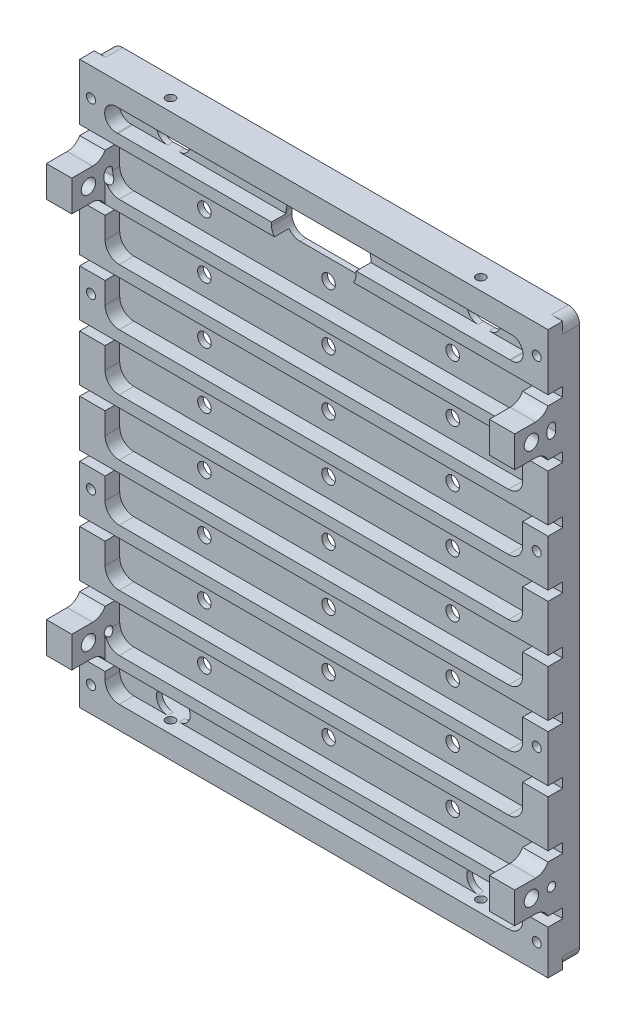
from build123d import *

# Parameters (mm, degrees)
SKETCH1_W                                 = 83
SKETCH1_H                                 = 49.75
BOSS_EXTRUDE1_DEPTH                       = 2.6
BOSS_EXTRUDE3_DEPTH                       = 3
SKETCH3_W                                 = 74
SKETCH3_H                                 = 91.5
CUT_EXTRUDE1_DEPTH                        = 2.6
SKETCH6_W                                 = 19.5
SKETCH6_H                                 = 24.25
SKETCH6_W_2                               = 30
SKETCH6_H_2                               = 37
CUT_EXTRUDE4_DEPTH                        = 2
FILLET6_R                                 = 2.5
FILLET6_OF_MIRROR7_R                      = 2.5
FILLET33_R                                = 2.5
SKETCH75_W                                = 74
SKETCH75_H                                = 2
BOSS_EXTRUDE17_DEPTH                      = 2.6
M2_CLEARANCE_HOLE2_D                      = 2.4
LPATTERN5_COUNT                           = 8
LPATTERN5_PITCH                           = 10
FILLET31_R                                = 2.5
SKETCH14_W                                = 2.6
SKETCH14_H                                = 1.7
CUT_EXTRUDE5_DEPTH                        = 65.856090693
LPATTERN2_COUNT                           = 9
LPATTERN2_PITCH                           = 10
M2X0_4_TAPPED_HOLE1_D                     = 1.6
CUT_EXTRUDE2_DEPTH                        = 65.856090693
CUT_EXTRUDE2_DEPTH_BACK                   = 65.856090693
SKETCH4_W                                 = 15
SKETCH4_H                                 = 6
FILLET4_R                                 = 2.5
SKETCH62_W                                = 4.5
SKETCH62_H                                = 8.4
BOSS_EXTRUDE15_DEPTH                      = 5.9
TAPPED_HOLE_FOR_M2_5X0_45_HELICOIL1_D     = 2.55
TAPPED_HOLE_FOR_M2_5X0_45_HELICOIL1_DEPTH = 83
F_1_5MM_START                             = 34.5
F_1_5MM_DOWEL_HOLE2_OUTLINE_R             = 0.75
F_1_5MM_DOWEL_HOLE2_DEPTH                 = 7.5
CUT_EXTRUDE28_DEPTH                       = 98.140684147
CUT_EXTRUDE28_DEPTH_BACK                  = 98.140684147
CUT_EXTRUDE27_START                       = -4.5
CUT_EXTRUDE27_DEPTH                       = 4.5
FILLET29_R                                = 2.5
M2X0_4_TAPPED_HOLE4_D                     = 1.6
M2X0_4_TAPPED_HOLE4_DEPTH                 = 4
M2X0_4_TAPPED_HOLE4_TIP                   = 0.480688495
M2X0_4_TAPPED_HOLE6_D                     = 1.6
M2X0_4_TAPPED_HOLE6_DEPTH                 = 4
M2X0_4_TAPPED_HOLE6_TIP                   = 0.480688495
TOPCUT_DEPTH                              = 66.341889384
CUT_EXTRUDE32_DEPTH                       = 3


with BuildPart() as part:
    # Sketch1 → Boss-Extrude1 (new body)
    with BuildSketch(Plane.XY):
        with Locations((0, 24.875)):
            Rectangle(SKETCH1_W, SKETCH1_H)
        with Locations((0, -24.875)):
            Rectangle(SKETCH1_W, SKETCH1_H)
    extrude(amount=BOSS_EXTRUDE1_DEPTH)

    # Sketch2 → Boss-Extrude3 (add)
    with BuildSketch(Plane.XY):
        with BuildLine():
            ThreePointArc((41.5, 47.75), (40.914213562, 49.164213562), (39.5, 49.75))
            Line((39.5, 49.75), (-39.5, 49.75))
            ThreePointArc((-39.5, 49.75), (-40.914213562, 49.164213562), (-41.5, 47.75))
            Line((-41.5, 47.75), (-41.5, -47.75))
            ThreePointArc((-41.5, -47.75), (-40.914213562, -49.164213562), (-39.5, -49.75))
            Line((-39.5, -49.75), (39.5, -49.75))
            ThreePointArc((39.5, -49.75), (40.914213562, -49.164213562), (41.5, -47.75))
            Line((41.5, -47.75), (41.5, 47.75))
        make_face()
    extrude(amount=-BOSS_EXTRUDE3_DEPTH)

    # Sketch3 → Cut-Extrude1 (cut)
    with BuildSketch(Plane.XY.offset(2.6)):
        Rectangle(SKETCH3_W, SKETCH3_H)
    extrude(amount=-CUT_EXTRUDE1_DEPTH, mode=Mode.SUBTRACT)

    # Sketch6 → Cut-Extrude4 (cut)
    with BuildSketch(Plane(origin=(0, 0, -3), x_dir=(-1, 0, 0), z_dir=(0, 0, -1))):
        with Locations((-27.75, 33.625)):
            Rectangle(SKETCH6_W, SKETCH6_H)
        with Locations((0, 33.625)):
            Rectangle(SKETCH6_W_2, SKETCH6_H)
        with Locations((27.75, 33.625)):
            Rectangle(SKETCH6_W, SKETCH6_H)
        with Locations((-27.75, 0)):
            Rectangle(SKETCH6_W, SKETCH6_H_2)
        Rectangle(SKETCH6_W_2, SKETCH6_H_2)
        with Locations((27.75, 0)):
            Rectangle(SKETCH6_W, SKETCH6_H_2)
        with Locations((-27.75, -33.625)):
            Rectangle(SKETCH6_W, SKETCH6_H)
        with Locations((0, -33.625)):
            Rectangle(SKETCH6_W_2, SKETCH6_H)
        with Locations((27.75, -33.625)):
            Rectangle(SKETCH6_W, SKETCH6_H)
    cut_extrude4 = extrude(amount=-CUT_EXTRUDE4_DEPTH, mode=Mode.SUBTRACT)

    # Fillet6
    fillet6_edges = [part.edges().sort_by_distance(p)[0] for p in [
        (15, -45.75, -2),
        (15, -21.5, -2),
        (-15, -21.5, -2),
        (-15, -45.75, -2),
        (37.5, -45.75, -2),
        (37.5, -21.5, -2),
        (18, -21.5, -2),
        (18, -45.75, -2),
        (-18, -18.5, -2),
        (-18, 18.5, -2),
        (-37.5, 18.5, -2),
        (-37.5, -18.5, -2),
        (37.5, 21.5, -2),
        (37.5, 45.75, -2),
        (18, 45.75, -2),
        (18, 21.5, -2),
        (15, 21.5, -2),
        (15, 45.75, -2),
        (-15, 45.75, -2),
        (-15, 21.5, -2),
        (-18, 21.5, -2),
        (-18, 45.75, -2),
        (-37.5, 45.75, -2),
        (-37.5, 21.5, -2),
        (37.5, -18.5, -2),
        (37.5, 18.5, -2),
        (18, 18.5, -2),
        (18, -18.5, -2),
        (15, -18.5, -2),
        (15, 18.5, -2),
        (-15, 18.5, -2),
        (-15, -18.5, -2),
        (-18, -45.75, -2),
        (-18, -21.5, -2),
        (-37.5, -21.5, -2),
        (-37.5, -45.75, -2),
    ]]
    fillet(fillet6_edges, radius=FILLET6_R)

    # Mirror7: Cut-Extrude4 across plane
    add(cut_extrude4.mirror(Plane.ZX), mode=Mode.SUBTRACT)

    # Fillet6 of Mirror7
    fillet6_of_mirror7_edges = [part.edges().sort_by_distance(p)[0] for p in [
        (15, 45.75, -2),
        (15, 21.5, -2),
        (-15, 21.5, -2),
        (-15, 45.75, -2),
        (37.5, 45.75, -2),
        (37.5, 21.5, -2),
        (18, 21.5, -2),
        (18, 45.75, -2),
        (-18, 18.5, -2),
        (-18, -18.5, -2),
        (-37.5, -18.5, -2),
        (-37.5, 18.5, -2),
        (37.5, -21.5, -2),
        (37.5, -45.75, -2),
        (18, -45.75, -2),
        (18, -21.5, -2),
        (15, -21.5, -2),
        (15, -45.75, -2),
        (-15, -45.75, -2),
        (-15, -21.5, -2),
        (-18, -21.5, -2),
        (-18, -45.75, -2),
        (-37.5, -45.75, -2),
        (-37.5, -21.5, -2),
        (37.5, 18.5, -2),
        (37.5, -18.5, -2),
        (18, -18.5, -2),
        (18, 18.5, -2),
        (15, 18.5, -2),
        (15, -18.5, -2),
        (-15, -18.5, -2),
        (-15, 18.5, -2),
        (-18, 45.75, -2),
        (-18, 21.5, -2),
        (-37.5, 21.5, -2),
        (-37.5, 45.75, -2),
    ]]
    fillet(fillet6_of_mirror7_edges, radius=FILLET6_OF_MIRROR7_R)

    # Fillet33
    fillet33_edges = [part.edges().sort_by_distance(p)[0] for p in [
        (-37, -45.75, 1.3),
        (-37, 45.75, 1.3),
        (37, 45.75, 1.3),
        (37, -45.75, 1.3),
    ]]
    fillet(fillet33_edges, radius=FILLET33_R)

    # Sketch75 → Boss-Extrude17 (add)
    with BuildSketch(Plane.XY):
        with Locations((0, 40.75)):
            Rectangle(SKETCH75_W, SKETCH75_H)
        with Locations((0, 30.75)):
            Rectangle(SKETCH75_W, SKETCH75_H)
        with Locations((0, 20.75)):
            Rectangle(SKETCH75_W, SKETCH75_H)
        with Locations((0, 10.75)):
            Rectangle(SKETCH75_W, SKETCH75_H)
        with Locations((0, 0.75)):
            Rectangle(SKETCH75_W, SKETCH75_H)
        with Locations((0, -9.25)):
            Rectangle(SKETCH75_W, SKETCH75_H)
        with Locations((0, -19.25)):
            Rectangle(SKETCH75_W, SKETCH75_H)
        with Locations((0, -29.25)):
            Rectangle(SKETCH75_W, SKETCH75_H)
        with Locations((0, -39.25)):
            Rectangle(SKETCH75_W, SKETCH75_H)
    extrude(amount=BOSS_EXTRUDE17_DEPTH)

    # M2 Clearance Hole2 (through all)
    with Locations(Plane(origin=(0, 0, -1), x_dir=(-1, 0, 0), z_dir=(0, 0, -1))):
        with Locations((0, -34.85), (22, -34.85), (-22, -34.85)):
            m2_clearance_hole2 = Hole(M2_CLEARANCE_HOLE2_D / 2)

    # LPattern5: M2 Clearance Hole2 ×8
    with Locations(*[(0, i * LPATTERN5_PITCH, 0) for i in range(1, LPATTERN5_COUNT)]):
        add(m2_clearance_hole2, mode=Mode.SUBTRACT)

    # Fillet31
    # the kernel refuses this fillet: 2.5 mm, written as the material it adds along each edge
    with BuildSketch(Plane(origin=(37, 41.75, 0), x_dir=(0, 1, 0), z_dir=(0, 0, 1))) as fillet31_piece_1:
        with BuildLine():
            CenterArc((2.5, 2.291287847), FILLET31_R, 180, 66.421821522)
            Line((0, 2.291287847), (-0.05, 2.291287847))
            Line((-0.05, 2.291287847), (-0.05, 0))
            Line((-0.05, 0), (0, -0.05))
            ThreePointArc((0, -0.05), (0.75, -0.05), (1.48, -0.045825757))
            Line((1.48, -0.045825757), (1.5, 0))
        make_face()
    extrude(amount=2.6)
    with BuildSketch(Plane(origin=(-37, 41.75, 0), x_dir=(0, 1, 0), z_dir=(0, 0, 1))) as fillet31_piece_2:
        with BuildLine():
            CenterArc((2.5, -2.291287847), FILLET31_R, 113.578178478, 66.421821522)
            Line((0, -2.291287847), (-0.05, -2.291287847))
            Line((-0.05, -2.291287847), (-0.05, 0))
            Line((-0.05, 0), (0, 0.05))
            ThreePointArc((0, 0.05), (0.75, 0.05), (1.48, 0.045825757))
            Line((1.48, 0.045825757), (1.5, 0))
        make_face()
    extrude(amount=2.6)
    with BuildSketch(Plane(origin=(37, 21.75, 0), x_dir=(0, 1, 0), z_dir=(0, 0, 1)), Plane(origin=(37, -38.25, 0), x_dir=(0, 1, 0), z_dir=(0, 0, 1)), Plane(origin=(37, 11.75, 0), x_dir=(0, 1, 0), z_dir=(0, 0, 1)), Plane(origin=(37, 1.75, 0), x_dir=(0, 1, 0), z_dir=(0, 0, 1)), Plane(origin=(37, -8.25, 0), x_dir=(0, 1, 0), z_dir=(0, 0, 1)), Plane(origin=(37, -18.25, 0), x_dir=(0, 1, 0), z_dir=(0, 0, 1)), Plane(origin=(37, -28.25, 0), x_dir=(0, 1, 0), z_dir=(0, 0, 1)), Plane(origin=(37, 31.75, 0), x_dir=(0, 1, 0), z_dir=(0, 0, 1))) as fillet31_piece_3:
        with BuildLine():
            CenterArc((FILLET31_R, FILLET31_R), FILLET31_R, 180, 90)
            Line((0, FILLET31_R), (-FILLET31_R * 0.0199999999999, FILLET31_R))
            Line((-FILLET31_R * 0.0199999999999, FILLET31_R), (-FILLET31_R * 0.02, -FILLET31_R * 0.02))
            Line((-FILLET31_R * 0.02, -FILLET31_R * 0.02), (FILLET31_R, -FILLET31_R * 0.02))
            Line((FILLET31_R, -FILLET31_R * 0.02), (FILLET31_R, 0))
        make_face()
    extrude(amount=2.6)
    with BuildSketch(Plane(origin=(-37, 21.75, 0), x_dir=(0, 1, 0), z_dir=(0, 0, 1)), Plane(origin=(-37, -38.25, 0), x_dir=(0, 1, 0), z_dir=(0, 0, 1)), Plane(origin=(-37, 11.75, 0), x_dir=(0, 1, 0), z_dir=(0, 0, 1)), Plane(origin=(-37, 1.75, 0), x_dir=(0, 1, 0), z_dir=(0, 0, 1)), Plane(origin=(-37, -8.25, 0), x_dir=(0, 1, 0), z_dir=(0, 0, 1)), Plane(origin=(-37, -18.25, 0), x_dir=(0, 1, 0), z_dir=(0, 0, 1)), Plane(origin=(-37, -28.25, 0), x_dir=(0, 1, 0), z_dir=(0, 0, 1)), Plane(origin=(-37, 31.75, 0), x_dir=(0, 1, 0), z_dir=(0, 0, 1))) as fillet31_piece_4:
        with BuildLine():
            CenterArc((FILLET31_R, -FILLET31_R), FILLET31_R, 90, 90)
            Line((0, -FILLET31_R), (-FILLET31_R * 0.02, -FILLET31_R))
            Line((-FILLET31_R * 0.02, -FILLET31_R), (-FILLET31_R * 0.02, FILLET31_R * 0.02))
            Line((-FILLET31_R * 0.02, FILLET31_R * 0.02), (FILLET31_R, FILLET31_R * 0.02))
            Line((FILLET31_R, FILLET31_R * 0.02), (FILLET31_R, 0))
        make_face()
    extrude(amount=2.6)

    # Sketch14 → Cut-Extrude5 (cut, symmetric)
    with BuildSketch(Plane(origin=(0, 0, 0), x_dir=(0, 0, -1), z_dir=(1, 0, 0))):
        with Locations((-1.3, 38.9)):
            Rectangle(SKETCH14_W, SKETCH14_H)
    cut_extrude5 = extrude(amount=CUT_EXTRUDE5_DEPTH, both=True, mode=Mode.SUBTRACT)

    # LPattern2: Cut-Extrude5 ×9
    with Locations(*[(0, -i * LPATTERN2_PITCH, 0) for i in range(1, LPATTERN2_COUNT)]):
        add(cut_extrude5, mode=Mode.SUBTRACT)

    # M2x0.4 Tapped Hole1 (through all)
    with Locations(Plane(origin=(0, 0, -3), x_dir=(-1, 0, 0), z_dir=(0, 0, -1))):
        with Locations((-39.5, -45.25), (39.5, -45.25), (39.5, -15.25), (-39.5, -15.25), (-39.5, 14.75), (39.5, 44.75), (-39.5, 44.75), (39.5, 14.75)):
            Hole(M2X0_4_TAPPED_HOLE1_D / 2)

    # Sketch4 → Cut-Extrude2 (cut, two sides: drawn at the far end of the back side and taken through both)
    with BuildSketch(Plane.XY.offset(-CUT_EXTRUDE2_DEPTH_BACK)):
        with Locations((0, 41.75)):
            Rectangle(SKETCH4_W, SKETCH4_H)
    extrude(amount=CUT_EXTRUDE2_DEPTH + CUT_EXTRUDE2_DEPTH_BACK, mode=Mode.SUBTRACT)

    # Fillet4
    fillet4_edges = [part.edges().sort_by_distance(p)[0] for p in [
        (7.5, 38.75, -0.5),
        (-7.5, 38.75, -0.5),
        (-7.5, 44.75, -0.5),
        (7.5, 44.75, -0.5),
    ]]
    fillet(fillet4_edges, radius=FILLET4_R)

    # Sketch62 → Boss-Extrude15 (add)
    with BuildSketch(Plane.XY.offset(2.6)):
        with Locations((39.25, 33.95)):
            Rectangle(SKETCH62_W, SKETCH62_H)
        with Locations((39.25, -36.05)):
            Rectangle(SKETCH62_W, SKETCH62_H)
    boss_extrude15 = extrude(amount=BOSS_EXTRUDE15_DEPTH)

    # Tapped Hole for M2.5x0.45 Helicoil1
    with Locations(Plane(origin=(41.5, 0, 0), x_dir=(0, 0, -1), z_dir=(1, 0, 0))):
        with Locations((-5.55, 33.95), (-5.55, -36.05)):
            tapped_hole_for_m2_5x0_45_helicoil1 = Hole(TAPPED_HOLE_FOR_M2_5X0_45_HELICOIL1_D / 2, depth=TAPPED_HOLE_FOR_M2_5X0_45_HELICOIL1_DEPTH)

    # Mirror13: Boss-Extrude15, Tapped Hole for M2.5x0.45 Helicoil1 across plane
    add(boss_extrude15.mirror(Plane(origin=(0, 0, 0), x_dir=(0, 0, 1), z_dir=(1, 0, 0))))
    add(tapped_hole_for_m2_5x0_45_helicoil1.mirror(Plane(origin=(0, 0, 0), x_dir=(0, 0, 1), z_dir=(1, 0, 0))), mode=Mode.SUBTRACT)

    # Ø1.5mm Dowel Hole2: read off the stored shape, not the designer's step
    # Ø1.5mm Dowel Hole2 outline → Ø1.5mm Dowel Hole2 (cut)
    with BuildSketch(Plane.YZ.offset(F_1_5MM_START)):
        with Locations((-36.05, 2)):
            Circle(F_1_5MM_DOWEL_HOLE2_OUTLINE_R)
    f_1_5mm_dowel_hole2 = extrude(amount=F_1_5MM_DOWEL_HOLE2_DEPTH, mode=Mode.SUBTRACT)

    # Mirror14: Ø1.5mm Dowel Hole2 across plane
    add(f_1_5mm_dowel_hole2.mirror(Plane(origin=(0, 0, 0), x_dir=(0, 0, 1), z_dir=(1, 0, 0))), mode=Mode.SUBTRACT)

    # Sketch71 → Cut-Extrude28 (cut, two sides: drawn at the far end of the back side and taken through both)
    with BuildSketch(Plane(origin=(41.5, 0, 0), x_dir=(0, 0, -1), z_dir=(1, 0, 0)).offset(-CUT_EXTRUDE28_DEPTH_BACK)):
        with BuildLine():
            Line((-1.25, 34.45), (-1.25, 33.45))
            ThreePointArc((-1.25, 33.45), (-2, 32.7), (-2.75, 33.45))
            Line((-2.75, 33.45), (-2.75, 34.45))
            ThreePointArc((-2.75, 34.45), (-2, 35.2), (-1.25, 34.45))
        make_face()
    extrude(amount=CUT_EXTRUDE28_DEPTH + CUT_EXTRUDE28_DEPTH_BACK, mode=Mode.SUBTRACT)

    # Sketch69 → Cut-Extrude27 (cut)
    with BuildSketch(Plane(origin=(41.5, 0, 0), x_dir=(0, 0, -1), z_dir=(1, 0, 0)).offset(CUT_EXTRUDE27_START)):
        Polygon((-2.6, -31.85), (-8.5, -31.85), (-8.6, -31.85), (-8.6, -40.25), (-8.5, -40.25), (-2.6, -40.25), (-2.6, -38.8), (-8.5, -38.8), (-8.5, -33.3), (-2.6, -33.3), align=None)
        Polygon((-2.6, 38.15), (-8.5, 38.15), (-8.6, 38.15), (-8.6, 29.75), (-8.5, 29.75), (-2.6, 29.75), (-2.6, 31.2), (-8.5, 31.2), (-8.5, 36.7), (-2.6, 36.7), align=None)
    cut_extrude27 = extrude(amount=CUT_EXTRUDE27_DEPTH, mode=Mode.SUBTRACT)

    # Mirror16: Cut-Extrude27 across plane
    add(cut_extrude27.mirror(Plane(origin=(0, 0, 0), x_dir=(0, 0, 1), z_dir=(1, 0, 0))), mode=Mode.SUBTRACT)

    # Fillet29
    # the kernel refuses this fillet: 2.5 mm, written as the material it adds along each edge
    with BuildSketch(Plane(origin=(37, -33.3, 2.6), x_dir=(0, 0, 1), z_dir=(1, 0, 0)), Plane(origin=(37, 36.7, 2.6), x_dir=(0, 0, 1), z_dir=(1, 0, 0))) as fillet29_piece_1:
        with BuildLine():
            CenterArc((2.219797288, -2.5), FILLET29_R, 90, 62.612892497)
            Line((0, -1.35), (-0.044395946, -1.327))
            ThreePointArc((-0.044395946, -1.327), (-0.05, -0.675), (-0.05, 0))
            Line((-0.05, 0), (0, 0.05))
            Line((0, 0.05), (2.219797288, 0.05))
            Line((2.219797288, 0.05), (2.219797288, 0))
        make_face()
    extrude(amount=4.5)
    with BuildSketch(Plane(origin=(37, -38.8, 2.6), x_dir=(0, -1, 0), z_dir=(1, 0, 0)), Plane(origin=(37, 31.2, 2.6), x_dir=(0, -1, 0), z_dir=(1, 0, 0))) as fillet29_piece_2:
        with BuildLine():
            CenterArc((2.5, -2.268810261), FILLET29_R, 114.83458749, 65.16541251)
            Line((0, -2.268810261), (-0.05, -2.268810261))
            Line((-0.05, -2.268810261), (-0.05, 0))
            Line((-0.05, 0), (0, 0.05))
            ThreePointArc((0, 0.05), (0.725, 0.05), (1.429, 0.045376205))
            Line((1.429, 0.045376205), (1.45, 0))
        make_face()
    extrude(amount=4.5)
    with BuildSketch(Plane(origin=(-37, -38.8, 2.6), x_dir=(0, 0, 1), z_dir=(-1, 0, 0))) as fillet29_piece_3:
        with BuildLine():
            CenterArc((2.268810261, -2.5), FILLET29_R, 90, 65.16541251)
            Line((0, -1.45), (-0.045376205, -1.429))
            ThreePointArc((-0.045376205, -1.429), (-0.05, -0.725), (-0.05, 0))
            Line((-0.05, 0), (0, 0.05))
            Line((0, 0.05), (2.268810261, 0.05))
            Line((2.268810261, 0.05), (2.268810261, 0))
        make_face()
    extrude(amount=4.5)
    with BuildSketch(Plane(origin=(-37, -33.3, 2.6), x_dir=(0, 1, 0), z_dir=(-1, 0, 0))) as fillet29_piece_4:
        with BuildLine():
            CenterArc((2.5, -2.219797288), FILLET29_R, 117.387107503, 62.612892497)
            Line((0, -2.219797288), (-0.05, -2.219797288))
            Line((-0.05, -2.219797288), (-0.05, 0))
            Line((-0.05, 0), (0, 0.05))
            ThreePointArc((0, 0.05), (0.675, 0.05), (1.327, 0.044395946))
            Line((1.327, 0.044395946), (1.35, 0))
        make_face()
    extrude(amount=4.5)
    with BuildSketch(Plane(origin=(-37, 31.2, 2.6), x_dir=(0, -1, 0), z_dir=(-1, 0, 0))) as fillet29_piece_5:
        with BuildLine():
            CenterArc((2.5, 2.268810261), FILLET29_R, 180, 65.16541251)
            Line((0, 2.268810261), (-0.05, 2.268810261))
            Line((-0.05, 2.268810261), (-0.05, 0))
            Line((-0.05, 0), (0, -0.05))
            ThreePointArc((0, -0.05), (0.725, -0.05), (1.429, -0.045376205))
            Line((1.429, -0.045376205), (1.45, 0))
        make_face()
    extrude(amount=4.5)
    with BuildSketch(Plane(origin=(-37, 36.7, 2.6), x_dir=(0, 0, 1), z_dir=(-1, 0, 0))) as fillet29_piece_6:
        with BuildLine():
            CenterArc((2.219797288, 2.5), FILLET29_R, 207.387107503, 62.612892497)
            Line((0, 1.35), (-0.044395946, 1.327))
            ThreePointArc((-0.044395946, 1.327), (-0.05, 0.675), (-0.05, 0))
            Line((-0.05, 0), (0, -0.05))
            Line((0, -0.05), (2.219797288, -0.05))
            Line((2.219797288, -0.05), (2.219797288, 0))
        make_face()
    extrude(amount=4.5)

    # M2x0.4 Tapped Hole4
    with Locations(Plane(origin=(0, 49.75, 0), x_dir=(1, 0, 0), z_dir=(0, 1, 0))):
        with Locations((-27.5, -0.5), (27.5, -0.5)):
            Hole(M2X0_4_TAPPED_HOLE4_D / 2, depth=M2X0_4_TAPPED_HOLE4_DEPTH)
            with Locations((0, 0, -(M2X0_4_TAPPED_HOLE4_DEPTH + M2X0_4_TAPPED_HOLE4_TIP / 2))):  # 118° drill point
                Cone(0, M2X0_4_TAPPED_HOLE4_D / 2, M2X0_4_TAPPED_HOLE4_TIP, mode=Mode.SUBTRACT)

    # M2x0.4 Tapped Hole6
    with Locations(Plane(origin=(0, -49.75, 0), x_dir=(-1, 0, 0), z_dir=(0, -1, 0))):
        with Locations((27.5, -0.5), (-27.5, -0.5)):
            Hole(M2X0_4_TAPPED_HOLE6_D / 2, depth=M2X0_4_TAPPED_HOLE6_DEPTH)
            with Locations((0, 0, -(M2X0_4_TAPPED_HOLE6_DEPTH + M2X0_4_TAPPED_HOLE6_TIP / 2))):  # 118° drill point
                Cone(0, M2X0_4_TAPPED_HOLE6_D / 2, M2X0_4_TAPPED_HOLE6_TIP, mode=Mode.SUBTRACT)

    # Sketch79 → TopCut (cut, through all)
    with BuildSketch(Plane.XY):
        with BuildLine():
            Line((35.063508327, 45.75), (34.5, 45.75))
            ThreePointArc((34.5, 45.75), (36.267766953, 45.017766953), (37, 43.25))
            ThreePointArc((37, 43.25), (36.644647157, 44.974744871), (35.063508327, 45.75))
        make_face()
        with BuildLine():
            ThreePointArc((-34.797518413, 45.732233429), (-36.559507902, 45.077397932), (-37, 43.25))
            ThreePointArc((-37, 43.25), (-36.369999469, 44.909247415), (-34.797518413, 45.732233429))
        make_face()
        with BuildLine():
            ThreePointArc((-37, 43.25), (-36.220910056, 42.118920224), (-34.896011853, 41.757026109))
            ThreePointArc((-34.896011853, 41.757026109), (-36.155464314, 42.21115028), (-37, 43.25))
        make_face()
        with BuildLine():
            ThreePointArc((37, 43.25), (36.155464314, 42.21115028), (34.896011853, 41.757026109))
            ThreePointArc((34.896011853, 41.757026109), (36.220910056, 42.118920224), (37, 43.25))
        make_face()
    extrude(amount=TOPCUT_DEPTH, mode=Mode.SUBTRACT)

    # Sketch84 → Cut-Extrude32 (cut)
    with BuildSketch(Plane.XY):
        with BuildLine():
            Line((-28.5, 45.75), (-26.5, 45.75))
            ThreePointArc((-26.5, 45.75), (-24.5, 43.75), (-26.5, 41.75))
            Line((-26.5, 41.75), (-28.5, 41.75))
            ThreePointArc((-28.5, 41.75), (-30.5, 43.75), (-28.5, 45.75))
        make_face()
        with BuildLine():
            Line((-28.5, -41.75), (-26.5, -41.75))
            ThreePointArc((-26.5, -41.75), (-24.5, -43.75), (-26.5, -45.75))
            Line((-26.5, -45.75), (-28.5, -45.75))
            ThreePointArc((-28.5, -45.75), (-30.5, -43.75), (-28.5, -41.75))
        make_face()
        with BuildLine():
            Line((28.5, -41.75), (26.5, -41.75))
            ThreePointArc((26.5, -41.75), (24.5, -43.75), (26.5, -45.75))
            Line((26.5, -45.75), (28.5, -45.75))
            ThreePointArc((28.5, -45.75), (30.5, -43.75), (28.5, -41.75))
        make_face()
    cut_extrude32 = extrude(amount=-CUT_EXTRUDE32_DEPTH, mode=Mode.SUBTRACT)

    # Mirror15: Cut-Extrude32 across plane
    add(cut_extrude32.mirror(Plane(origin=(0, 0, 0), x_dir=(0, 0, 1), z_dir=(1, 0, 0))), mode=Mode.SUBTRACT)


solid = part.part
